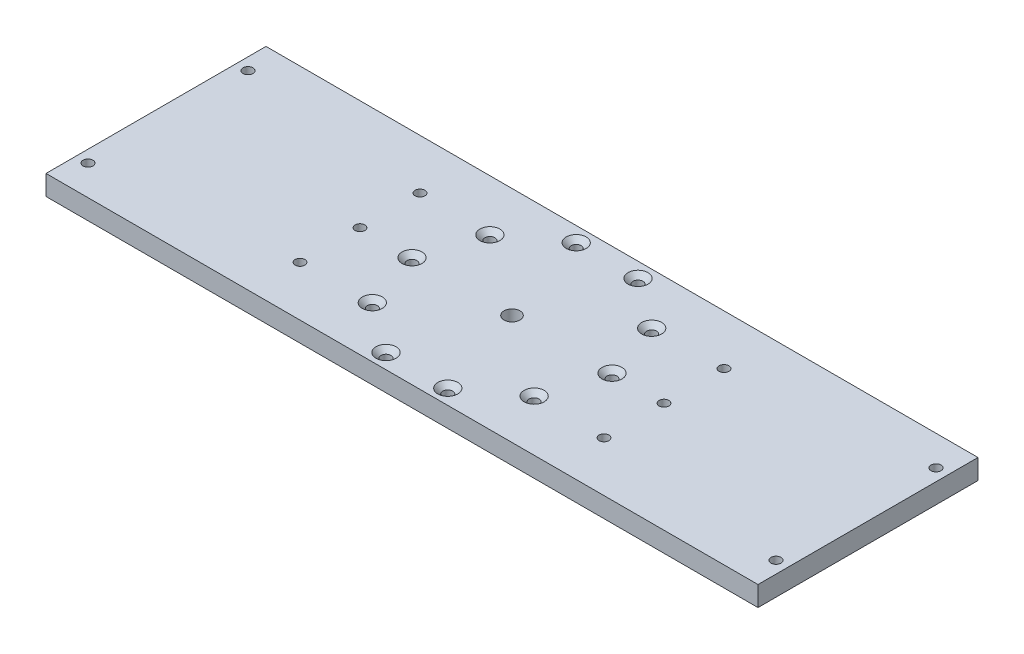
from build123d import *

# Parameters (mm, degrees)
SKIZZE3_W                       = 356
SKIZZE3_H                       = 110
AUFSATZ_LINEAR_AUSTRAGEN1_DEPTH = 10
SKIZZE4_R                       = 2.5
SCHNITT_LINEAR_AUSTRAGEN1_DEPTH = 373.741197079
SKIZZE5_R                       = 2.45
SCHNITT_LINEAR_AUSTRAGEN2_DEPTH = 373.741197079
SKIZZE7_R                       = 2.5
SCHNITT_LINEAR_AUSTRAGEN3_DEPTH = 373.741197079
F_8_0_8_DURCHMESSER_BOHRUNG1_D  = 8
FASE1_SIZE                      = 2.5
FASE2_SIZE                      = 2.5


with BuildPart() as part:
    # Skizze3 → Aufsatz-Linear austragen1 (new body)
    with BuildSketch(Plane(origin=(0, 0, 0), x_dir=(1, 0, 0), z_dir=(0, 1, 0))):
        with Locations((178, 55)):
            Rectangle(SKIZZE3_W, SKIZZE3_H)
    extrude(amount=AUFSATZ_LINEAR_AUSTRAGEN1_DEPTH)

    # Skizze4 → Schnitt-Linear austragen1 (cut, through all)
    with BuildSketch(Plane(origin=(0, 10, 0), x_dir=(1, 0, 0), z_dir=(0, 1, 0))):
        with Locations(Location((128, 55, 0), (0, 0, 270))):
            Circle(SKIZZE4_R)
        with Locations(Location((137.549150281, 84.389262615, 0), (0, 0, 270))):
            Circle(SKIZZE4_R)
        with Locations(Location((162.549150281, 102.552825815, 0), (0, 0, 270))):
            Circle(SKIZZE4_R)
        with Locations(Location((193.450849719, 102.552825815, 0), (0, 0, 270))):
            Circle(SKIZZE4_R)
        with Locations(Location((218.450849719, 84.389262615, 0), (0, 0, 270))):
            Circle(SKIZZE4_R)
        with Locations(Location((228, 55, 0), (0, 0, 270))):
            Circle(SKIZZE4_R)
        with Locations(Location((218.450849719, 25.610737385, 0), (0, 0, 270))):
            Circle(SKIZZE4_R)
        with Locations(Location((193.450849719, 7.447174185, 0), (0, 0, 270))):
            Circle(SKIZZE4_R)
        with Locations(Location((162.549150281, 7.447174185, 0), (0, 0, 270))):
            Circle(SKIZZE4_R)
        with Locations(Location((137.549150281, 25.610737385, 0), (0, 0, 270))):
            Circle(SKIZZE4_R)
    extrude(amount=-SCHNITT_LINEAR_AUSTRAGEN1_DEPTH, mode=Mode.SUBTRACT)

    # Skizze5 → Schnitt-Linear austragen2 (cut, through all)
    with BuildSketch(Plane(origin=(0, 10, 0), x_dir=(1, 0, 0), z_dir=(0, 1, 0))):
        with Locations(Location((102, 85, 0), (0, 0, 270))):
            Circle(SKIZZE5_R)
        with Locations(Location((102, 25, 0), (0, 0, 270))):
            Circle(SKIZZE5_R)
        with Locations(Location((254, 25, 0), (0, 0, 270))):
            Circle(SKIZZE5_R)
        with Locations(Location((254, 85, 0), (0, 0, 270))):
            Circle(SKIZZE5_R)
        with Locations(Location((102, 55, 0), (0, 0, 270))):
            Circle(SKIZZE5_R)
        with Locations(Location((254, 55, 0), (0, 0, 270))):
            Circle(SKIZZE5_R)
    extrude(amount=-SCHNITT_LINEAR_AUSTRAGEN2_DEPTH, mode=Mode.SUBTRACT)

    # Skizze7 → Schnitt-Linear austragen3 (cut, through all)
    with BuildSketch(Plane(origin=(0, 10, 0), x_dir=(1, 0, 0), z_dir=(0, 1, 0))):
        with Locations(Location((6, 95, 0), (0, 0, 270))):
            Circle(SKIZZE7_R)
        with Locations(Location((6, 15, 0), (0, 0, 270))):
            Circle(SKIZZE7_R)
        with Locations(Location((350, 15, 0), (0, 0, 270))):
            Circle(SKIZZE7_R)
        with Locations(Location((350, 95, 0), (0, 0, 270))):
            Circle(SKIZZE7_R)
    extrude(amount=-SCHNITT_LINEAR_AUSTRAGEN3_DEPTH, mode=Mode.SUBTRACT)

    # Ø8.0 (8) Durchmesser Bohrung1 (through all)
    with Locations(Plane(origin=(0, 10, 0), x_dir=(1, 0, 0), z_dir=(0, 1, 0))):
        with Locations((178, 55)):
            Hole(F_8_0_8_DURCHMESSER_BOHRUNG1_D / 2)

    # Fase1
    fase1_edges = [part.edges().sort_by_distance(p)[0] for p in [
        (128, 10, -57.5),
        (137.549150281, 10, -28.110737385),
        (162.549150281, 10, -9.947174185),
        (193.450849719, 10, -9.947174185),
        (218.450849719, 10, -28.110737385),
        (228, 10, -57.5),
        (218.450849719, 10, -86.889262615),
        (193.450849719, 10, -105.052825815),
        (162.549150281, 10, -105.052825815),
        (137.549150281, 10, -86.889262615),
    ]]
    chamfer(fase1_edges, length=FASE1_SIZE)

    # Fase2
    fase2_edges = [part.edges().sort_by_distance(p)[0] for p in [
        (6, 0, -17.5),
        (6, 0, -97.5),
        (102, 0, -27.45),
        (254, 0, -27.45),
        (254, 0, -87.45),
        (102, 0, -57.45),
        (254, 0, -57.45),
        (102, 0, -87.45),
        (350, 0, -97.5),
        (350, 0, -17.5),
    ]]
    chamfer(fase2_edges, length=FASE2_SIZE)


solid = part.part
